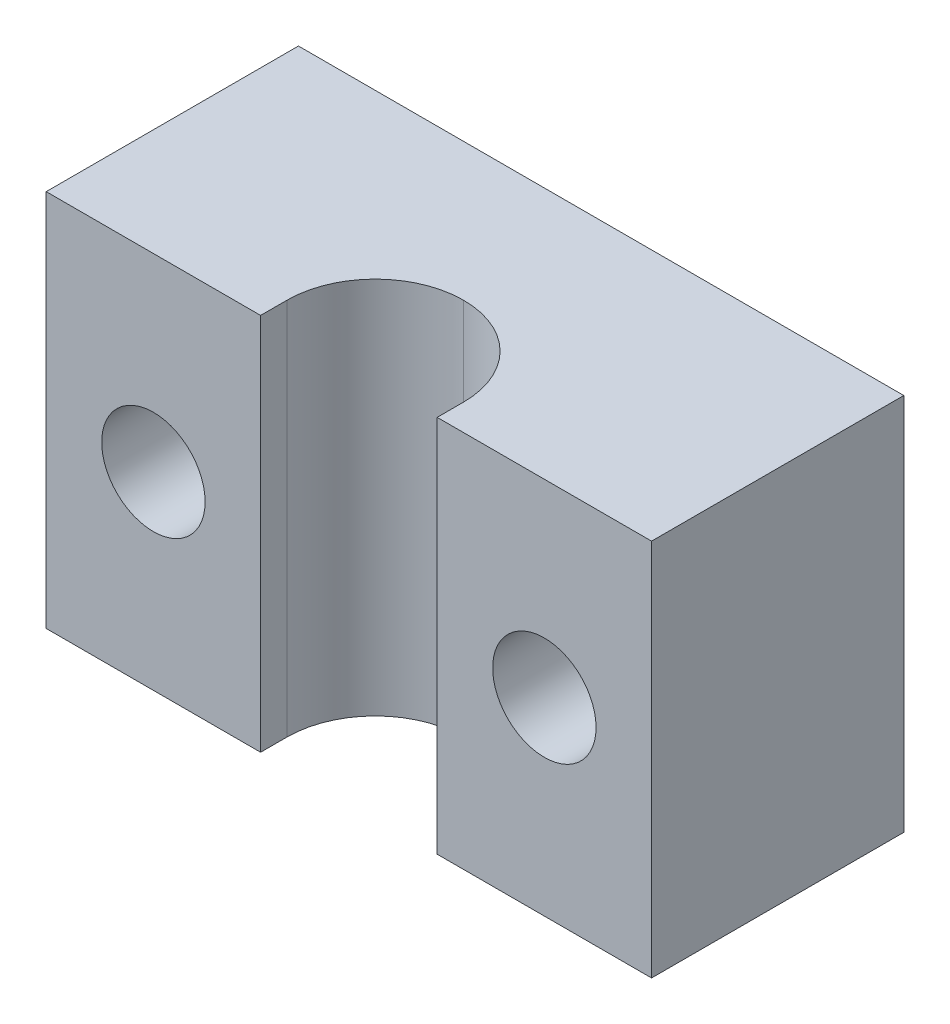
from build123d import *

# Parameters (mm, degrees)
BOSS_EXTRUDE1_DEPTH = 30
SKETCH3_R           = 4.1
CUT_EXTRUDE1_DEPTH  = 81.160460929
SKETCH4_R           = 4.1
CUT_EXTRUDE2_DEPTH  = 72.938334134
FILLET1_R           = 7
SKETCH6_W           = 10
SKETCH6_H           = 50
CUT_EXTRUDE3_DEPTH  = 71.426013762


with BuildPart() as part:
    # Sketch1 → Boss-Extrude1 (new body)
    with BuildSketch(Plane(origin=(0, 0, 0), x_dir=(1, 0, 0), z_dir=(0, 1, 0))):
        Polygon((-22.986013986, 8.601398601), (-22.986013986, -11.398601399), (-5.986013986, -11.398601399), (-5.986013986, -2.307692308), (8.013986014, -2.307692308), (8.013986014, -11.398601399), (25.013986014, -11.398601399), (25.013986014, 8.601398601), (6.013986014, 8.601398601), (6.013986014, 58.601398601), (-3.986013986, 58.601398601), (-3.986013986, 8.601398601), align=None)
    extrude(amount=BOSS_EXTRUDE1_DEPTH)

    # Sketch3 → Cut-Extrude1 (cut, through all)
    with BuildSketch(Plane.XY.offset(11.398601399)):
        with Locations((-14.486013986, 15)):
            Circle(SKETCH3_R)
        with Locations((16.513986014, 15)):
            Circle(SKETCH3_R)
    extrude(amount=-CUT_EXTRUDE1_DEPTH, mode=Mode.SUBTRACT)

    # Sketch4 → Cut-Extrude2 (cut, through all)
    with BuildSketch(Plane(origin=(6.013986014, 0, 0), x_dir=(0, 0, -1), z_dir=(1, 0, 0))):
        with Locations((28.601398601, 15)):
            Circle(SKETCH4_R)
        with Locations((48.601398601, 15)):
            Circle(SKETCH4_R)
    extrude(amount=-CUT_EXTRUDE2_DEPTH, mode=Mode.SUBTRACT)

    # Fillet1
    fillet1_edges = [part.edges().sort_by_distance(p)[0] for p in [
        (-5.986013986, 15, 2.307692308),
        (8.013986014, 15, 2.307692308),
    ]]
    fillet(fillet1_edges, radius=FILLET1_R - 0.0001)  # a hair under: the kernel refuses the full size

    # Sketch6 → Cut-Extrude3 (cut, through all)
    with BuildSketch(Plane(origin=(0, 30, 0), x_dir=(1, 0, 0), z_dir=(0, 1, 0))):
        with Locations((1.013986014, 33.601398601)):
            Rectangle(SKETCH6_W, SKETCH6_H)
    extrude(amount=-CUT_EXTRUDE3_DEPTH, mode=Mode.SUBTRACT)


solid = part.part
